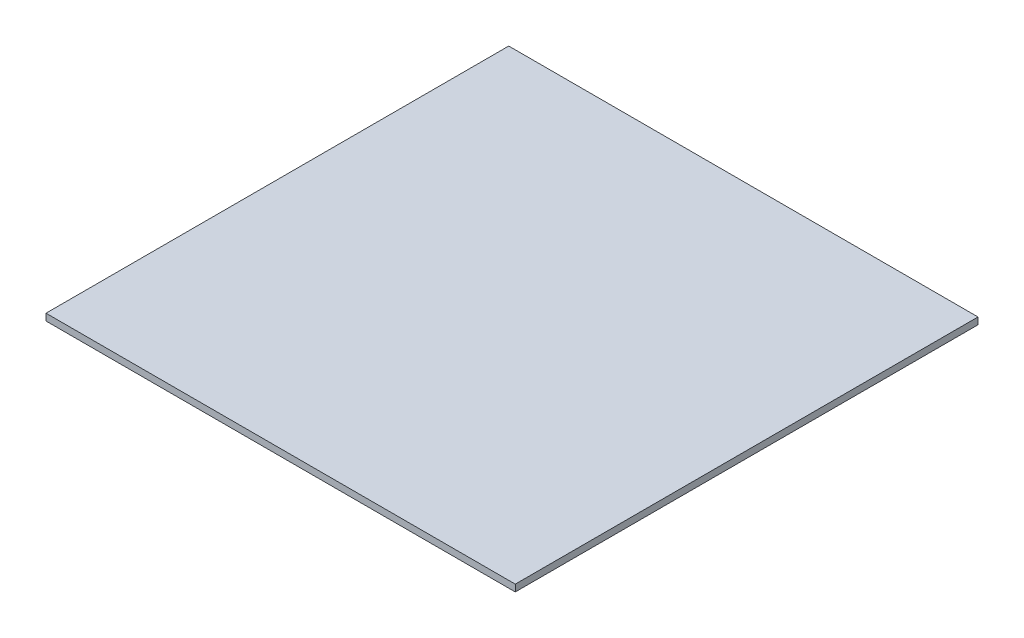
from build123d import *

# Parameters (mm, degrees)
SKETCH1_W           = 218.948
SKETCH1_H           = 215.9
BOSS_EXTRUDE1_DEPTH = 3.175


with BuildPart() as part:
    # Sketch1 → Boss-Extrude1 (new body)
    with BuildSketch(Plane(origin=(0, 0, 0), x_dir=(1, 0, 0), z_dir=(0, 1, 0))):
        with Locations((109.474, 107.95)):
            Rectangle(SKETCH1_W, SKETCH1_H)
    extrude(amount=BOSS_EXTRUDE1_DEPTH)


solid = part.part
